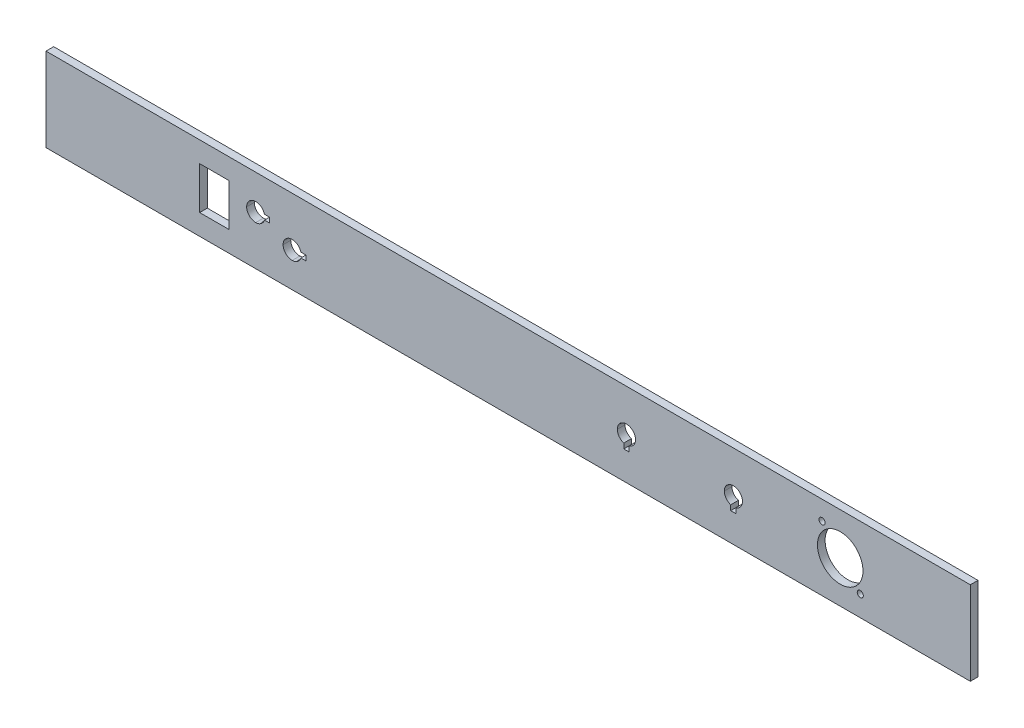
from build123d import *

# Parameters (mm, degrees)
SKETCH1_W           = 483
SKETCH1_H           = 43.7
BOSS_EXTRUDE1_DEPTH = 4
SKETCH2_R           = 11.9
SKETCH2_R_2         = 1.6
SKETCH2_W           = 15.417359221
SKETCH2_H           = 22.13620668
CUT_EXTRUDE1_DEPTH  = 4


with BuildPart() as part:
    # Sketch1 → Boss-Extrude1 (new body)
    with BuildSketch(Plane.XY):
        Rectangle(SKETCH1_W, SKETCH1_H)
    extrude(amount=BOSS_EXTRUDE1_DEPTH)

    # Sketch2 → Cut-Extrude1 (cut)
    with BuildSketch(Plane.XY.offset(4)):
        with Locations((173.5, 0)):
            Circle(SKETCH2_R)
        with Locations((183.993165462, -11.1)):
            Circle(SKETCH2_R_2)
        with Locations((163.993165462, 11.9)):
            Circle(SKETCH2_R_2)
        with Locations((-153.499204599, 0)):
            Rectangle(SKETCH2_W, SKETCH2_H)
        with BuildLine():
            Line((-127.368336195, 2.432488674), (-124.689048868, 2.432488674))
            Line((-124.689048868, 2.432488674), (-124.689048868, 5.074570565))
            Line((-124.689048868, 5.074570565), (-127.340430347, 5.074570565))
            add(Edge.make_bspline(
                [(-127.340430347, 5.074570565), (-127.89691412, 7.077712341), (-129.73708461, 8.553930632), (-131.917534978, 8.553930632)],
                knots=[0, 0, 0, 0, 1, 1, 1, 1], degree=3))
            add(Edge.make_bspline(
                [(-131.917534978, 8.553930632), (-134.539090466, 8.553930632), (-136.66209241, 6.430925145), (-136.66209241, 3.809348401)],
                knots=[0, 0, 0, 0, 1, 1, 1, 1], degree=3))
            add(Edge.make_bspline(
                [(-136.66209241, 3.809348401), (-136.66209241, 1.187778743), (-134.539090466, -0.944533418), (-131.917534978, -0.944533418)],
                knots=[0, 0, 0, 0, 1, 1, 1, 1], degree=3))
            add(Edge.make_bspline(
                [(-131.917534978, -0.944533418), (-129.774105825, -0.944533418), (-127.957862731, 0.481417503), (-127.368336195, 2.432488674)],
                knots=[0, 0, 0, 0, 1, 1, 1, 1], degree=3))
        make_face()
        with BuildLine():
            Line((-108.321601275, -5.186204585), (-105.642313949, -5.186204585))
            Line((-105.642313949, -5.186204585), (-105.642313949, -2.544122694))
            Line((-105.642313949, -2.544122694), (-108.293691885, -2.544122694))
            add(Edge.make_bspline(
                [(-108.293691885, -2.544122694), (-108.850175658, -0.540980918), (-110.690349691, 0.935237373), (-112.870800059, 0.935237373)],
                knots=[0, 0, 0, 0, 1, 1, 1, 1], degree=3))
            add(Edge.make_bspline(
                [(-112.870800059, 0.935237373), (-115.492355547, 0.935237373), (-117.615353949, -1.187768114), (-117.615353949, -3.809344858)],
                knots=[0, 0, 0, 0, 1, 1, 1, 1], degree=3))
            add(Edge.make_bspline(
                [(-117.615353949, -3.809344858), (-117.615353949, -6.430914517), (-115.492355547, -8.56323022), (-112.870800059, -8.56323022)],
                knots=[0, 0, 0, 0, 1, 1, 1, 1], degree=3))
            add(Edge.make_bspline(
                [(-112.870800059, -8.56323022), (-110.727370906, -8.56323022), (-108.911127812, -7.137279299), (-108.321601275, -5.186204585)],
                knots=[0, 0, 0, 0, 1, 1, 1, 1], degree=3))
        make_face()
        with BuildLine():
            Line((116.298959054, -7.22848611), (118.941040946, -7.22848611))
            Line((118.941040946, -7.22848611), (118.941040946, -4.577108174))
            add(Edge.make_bspline(
                [(118.941040946, -4.577108174), (120.944182721, -4.020624401), (122.420401012, -2.180450368), (122.420401012, 0)],
                knots=[0, 0, 0, 0, 1, 1, 1, 1], degree=3))
            add(Edge.make_bspline(
                [(122.420401012, 0), (122.420401012, 2.621555488), (120.297395525, 4.74455389), (117.675818781, 4.74455389)],
                knots=[0, 0, 0, 0, 1, 1, 1, 1], degree=3))
            add(Edge.make_bspline(
                [(117.675818781, 4.74455389), (115.054249123, 4.74455389), (112.92193342, 2.621555488), (112.92193342, 0)],
                knots=[0, 0, 0, 0, 1, 1, 1, 1], degree=3))
            add(Edge.make_bspline(
                [(112.92193342, 0), (112.92193342, -2.143429153), (114.347884341, -3.959672247), (116.298959054, -4.549198783)],
                knots=[0, 0, 0, 0, 1, 1, 1, 1], degree=3))
            Line((116.298959054, -4.549198783), (116.298959054, -7.22848611))
        make_face()
        with BuildLine():
            Line((60.418959054, -7.22848611), (63.061040946, -7.22848611))
            Line((63.061040946, -7.22848611), (63.061040946, -4.577108174))
            add(Edge.make_bspline(
                [(63.061040946, -4.577108174), (65.064182721, -4.020624401), (66.540401012, -2.180450368), (66.540401012, 0)],
                knots=[0, 0, 0, 0, 1, 1, 1, 1], degree=3))
            add(Edge.make_bspline(
                [(66.540401012, 0), (66.540401012, 2.621555488), (64.417395525, 4.74455389), (61.795818781, 4.74455389)],
                knots=[0, 0, 0, 0, 1, 1, 1, 1], degree=3))
            add(Edge.make_bspline(
                [(61.795818781, 4.74455389), (59.174249123, 4.74455389), (57.04193342, 2.621555488), (57.04193342, 0)],
                knots=[0, 0, 0, 0, 1, 1, 1, 1], degree=3))
            add(Edge.make_bspline(
                [(57.04193342, 0), (57.04193342, -2.143429153), (58.467884341, -3.959672247), (60.418959054, -4.549198783)],
                knots=[0, 0, 0, 0, 1, 1, 1, 1], degree=3))
            Line((60.418959054, -4.549198783), (60.418959054, -7.22848611))
        make_face()
    extrude(amount=-CUT_EXTRUDE1_DEPTH, mode=Mode.SUBTRACT)


solid = part.part
